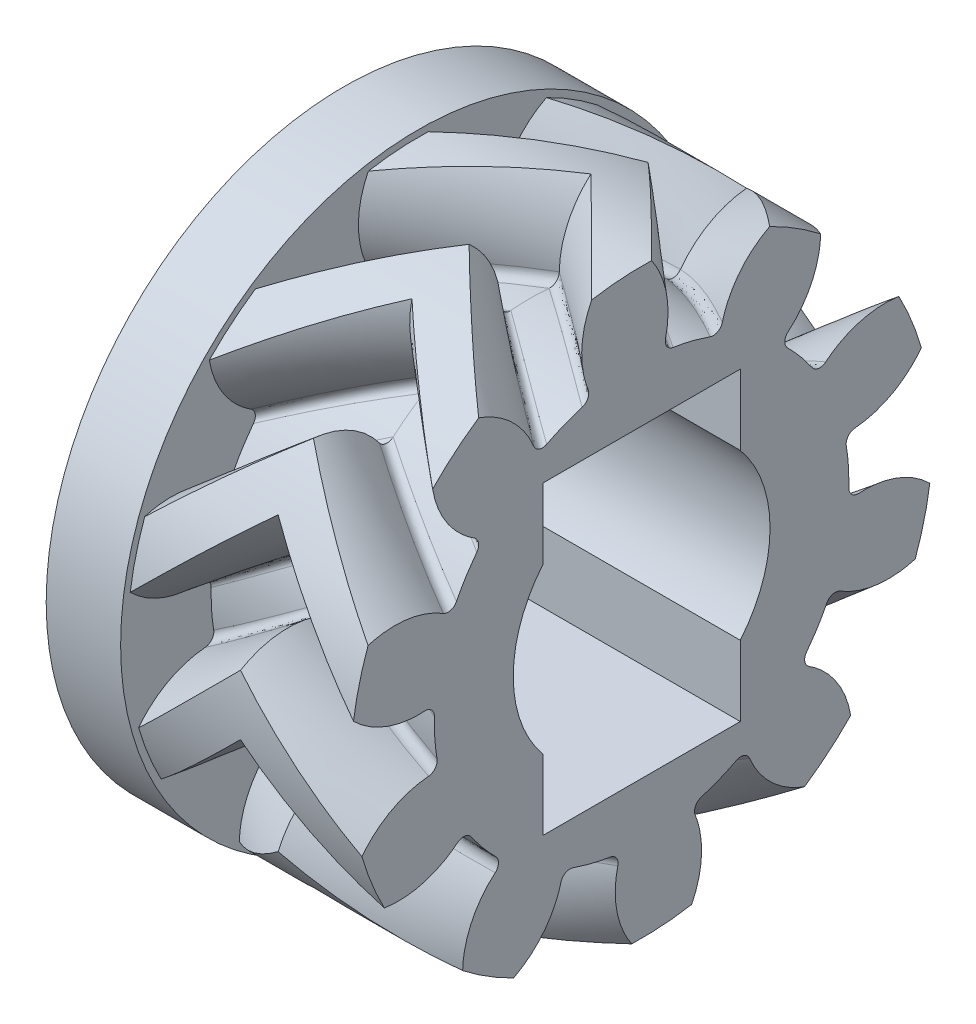
from build123d import *

# Parameters (mm, degrees)
BASPROSKE_W         = 3
BASPROSKE_H         = 7.821067812
TOOTHCUTRH_PITCH    = 49.141218362
TEETHCUTSRH_COUNT   = 10
TEETHCUTSRH_ANGLE   = 324
BORSKE_R            = 2
BORE_DEPTH          = 62.5000025
SKETCH_3_R          = 8
SKETCH_3_R_2        = 2
EXTRUDE_1_DEPTH     = 2
SKETCH_1_R          = 3.45
CUT_EXTRUDE_1_DEPTH = 14.856406576
SKETCH_2_W          = 5.3
SKETCH_2_H          = 8.2
CUT_EXTRUDE_2_DEPTH = 5.7


with BuildPart() as part:
    # BasProSke → Base-Revolve (revolve)
    with BuildSketch(Plane(origin=(0, 0, 0), x_dir=(1, 0, 0), z_dir=(0, 1, 0)), mode=Mode.PRIVATE) as base_revolve_sk:
        with Locations((1.5, 3.910533906)):
            Rectangle(BASPROSKE_W, BASPROSKE_H)
    revolve(base_revolve_sk.sketch.rotate(Axis((-10, 0, 0), (1, 0, 0)), 180), axis=Axis((-10, 0, 0), (1, 0, 0)))

    # ToothCutRH: the profile of TooCutSkeRH screwed along a right-hand helix of 0.061049 turns, 26 arcs to a turn; built about Z, then put on its axis
    toothcutrh_z = Axis((0, 0, 0), (0, 0, 1))
    toothcutrh_corners = [(5.54740917, -0.512882118, 0), (5.54740917, 0.512882118, 0), (5.611043231, 0.704195745, 0), (5.794883836, 0.786977562, 0), (7.834221117, 1.875974279, 0), (7.834221117, -1.875974279, 0), (5.794883836, -0.786977562, 0), (5.611043231, -0.704195745, 0)]
    with BuildLine(mode=Mode.PRIVATE) as toothcutrh_profile:
        ThreePointArc((5.54740917, -0.512882118, 0), (5.571067812, 0, 0), (5.54740917, 0.512882118, 0))
        ThreePointArc((5.54740917, 0.512882118, 0), (5.559172569, 0.615209099, 0), (5.611043231, 0.704195745, 0))
        ThreePointArc((5.611043231, 0.704195745, 0), (5.694286284, 0.764856957, 0), (5.794883836, 0.786977562, 0))
        ThreePointArc((5.794883836, 0.786977562, 0), (6.947994825, 1.081581727, 0), (7.834221117, 1.875974279, 0))
        ThreePointArc((7.834221117, 1.875974279, 0), (8.055699846, 0, 0), (7.834221117, -1.875974279, 0))
        ThreePointArc((7.834221117, -1.875974279, 0), (6.947994825, -1.081581727, 0), (5.794883836, -0.786977562, 0))
        ThreePointArc((5.794883836, -0.786977562, 0), (5.694286284, -0.764856957, 0), (5.611043231, -0.704195745, 0))
        ThreePointArc((5.611043231, -0.704195745, 0), (5.559172569, -0.615209099, 0), (5.54740917, -0.512882118, 0))
    toothcutrh_cap = Face(toothcutrh_profile.wire())
    toothcutrh_arcs = [((5.54740917, -0.512882118, 0), (5.594827354, 0, 0), (5.54740917, 0.512882118, 0), (1, 0.9957533020879911, 1)), ((5.54740917, 0.512882118, 0), (5.537275211, 0.622492521, 0), (5.611043231, 0.704195745, 0), (1, 0.915801426818008, 1)), ((5.611043231, 0.704195745, 0), (5.68481125, 0.785898968, 0), (5.794883836, 0.786977562, 0), (1, 0.915801426818008, 1)), ((5.794883836, 0.786977562, 0), (7.098490862, 0.799751513, 0), (7.834221117, 1.875974279, 0), (1, 0.8866834745538676, 1)), ((7.834221117, 1.875974279, 0), (8.283439929, 0, 0), (7.834221117, -1.875974279, 0), (1, 0.9725065812905824, 1)), ((7.834221117, -1.875974279, 0), (7.098490862, -0.799751513, 0), (5.794883836, -0.786977562, 0), (1, 0.8866834745538664, 1)), ((5.794883836, -0.786977562, 0), (5.68481125, -0.785898968, 0), (5.611043231, -0.704195745, 0), (1, 0.9158014268180066, 1)), ((5.611043231, -0.704195745, 0), (5.537275211, -0.622492521, 0), (5.54740917, -0.512882118, 0), (1, 0.9158014268180066, 1))]  # start, shoulder, end, weights
    toothcutrh_turn_angles = [0, 6.923076923, 13.846153846, 17.911815461, 21.977477075]
    toothcutrh_turn_weights = [1, 0.992708874098054, 1, 0.997483453494221, 1]
    toothcutrh_turn_sides = [Face.make_bezier_surface([[Vector(p[j][0], p[j][1], 0).rotate(toothcutrh_z, toothcutrh_turn_angles[2 * i + k]) / toothcutrh_turn_weights[2 * i + k] + Vector(0, 0, p[j][2] + TOOTHCUTRH_PITCH * toothcutrh_turn_angles[2 * i + k] / 360) for k in range(3)] for j in range(3)], [[p[3][j] * toothcutrh_turn_weights[2 * i + k] for k in range(3)] for j in range(3)]) for p in toothcutrh_arcs for i in range(2)]
    toothcutrh = Plane(origin=(0, 0, 0), x_dir=(0, 1, 0), z_dir=(1, 0, 0)) * Solid(Shell([*toothcutrh_turn_sides, toothcutrh_cap, toothcutrh_cap.rotate(toothcutrh_z, 21.977477075).moved(Location((0, 0, TOOTHCUTRH_PITCH * 21.977477075 / 360)))]))
    add(toothcutrh, mode=Mode.SUBTRACT)

    # TeethCutsRH: ToothCutRH ×10 about axis
    teethcutsrh_axis = Axis((-10, 0, 0), (1, 0, 0))
    for i in range(1, TEETHCUTSRH_COUNT):
        add(toothcutrh.rotate(teethcutsrh_axis, i * TEETHCUTSRH_ANGLE / (TEETHCUTSRH_COUNT - 1)), mode=Mode.SUBTRACT)

    # BorSke → Bore (cut, symmetric)
    with BuildSketch(Plane(origin=(0, 0, 0), x_dir=(0, 0, -1), z_dir=(1, 0, 0))):
        with Locations(Location((0, 0, 0), (0, 0, 180))):
            Circle(BORSKE_R)
    extrude(amount=BORE_DEPTH, both=True, mode=Mode.SUBTRACT)

    # 鏡射1: part across plane


with BuildPart() as part_1:
    add(part.part)
    add(part.part.mirror(Plane(origin=(0, 0, 0), x_dir=(0, 0, 1), z_dir=(1, 0, 0))))

    # 草圖3 → 填料-伸長1 (add)
    with BuildSketch(Plane.ZY.offset(3)):
        Circle(SKETCH_3_R)
        Circle(SKETCH_3_R_2, mode=Mode.SUBTRACT)
    extrude(amount=EXTRUDE_1_DEPTH)

    # 草圖1 → 除料-伸長1 (cut, through all)
    with BuildSketch(Plane.ZY.offset(-3)):
        Circle(SKETCH_1_R)
    extrude(amount=CUT_EXTRUDE_1_DEPTH, mode=Mode.SUBTRACT)

    # 草圖2 → 除料-伸長2 (cut)
    with BuildSketch(Plane(origin=(3, 0, 0), x_dir=(0, 0, -1), z_dir=(1, 0, 0))):
        Rectangle(SKETCH_2_W, SKETCH_2_H)
    extrude(amount=-CUT_EXTRUDE_2_DEPTH, mode=Mode.SUBTRACT)


solid = part_1.part
